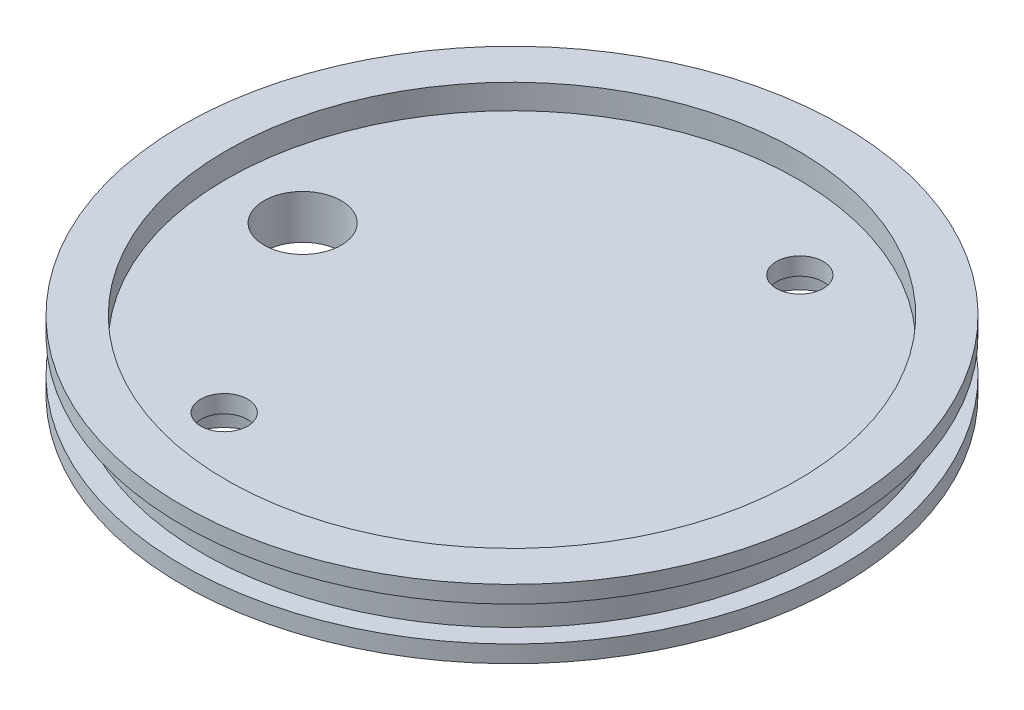
from build123d import *

# Parameters (mm, degrees)
PIPE_TAP_DRILL_FOR_1_4_TAP1_D                        = 11.1252
CBORE_FOR_1_4_BINDING_HEAD_MACHINE_SCREW_D           = 6.7564
CBORE_FOR_1_4_BINDING_HEAD_MACHINE_SCREW_CBORE_D     = 12.7
CBORE_FOR_1_4_BINDING_HEAD_MACHINE_SCREW_CBORE_DEPTH = 3.81
SKETCH7_R                                            = 11.1125
BOSS_EXTRUDE1_DEPTH                                  = 6.35


with BuildPart() as part:
    # Sketch1 → Revolve1 (revolve)
    with BuildSketch(Plane.XY):
        Polygon((0, 0), (47.498, 0), (47.498, 2.4638), (44.577, 2.4638), (44.577, 7.4422), (47.498, 7.4422), (47.498, 9.906), (41.148, 9.906), (41.148, 6.35), (0, 6.35), align=None)
    revolve(axis=Axis((0, 48.192213231, 0), (0, -1, 0)))

    # Pipe Tap Drill for 1/4 Tap1 (through all)
    with Locations(Plane(origin=(0, 6.35, 0), x_dir=(1, 0, 0), z_dir=(0, 1, 0))):
        with Locations((0, 0), (-30.1752, 0)):
            Hole(PIPE_TAP_DRILL_FOR_1_4_TAP1_D / 2)

    # CBORE for 1/4 Binding Head Machine Screw1 (through all)
    with Locations(Plane.XZ):
        with Locations((12.150198978, -29.333175157), (-12.150198978, 29.333175157)):
            CounterBoreHole(CBORE_FOR_1_4_BINDING_HEAD_MACHINE_SCREW_D / 2, CBORE_FOR_1_4_BINDING_HEAD_MACHINE_SCREW_CBORE_D / 2, CBORE_FOR_1_4_BINDING_HEAD_MACHINE_SCREW_CBORE_DEPTH)

    # Sketch7 → Boss-Extrude1 (add)
    with BuildSketch(Plane(origin=(0, 6.35, 0), x_dir=(1, 0, 0), z_dir=(0, 1, 0))):
        Circle(SKETCH7_R)
    extrude(amount=-BOSS_EXTRUDE1_DEPTH)


solid = part.part
